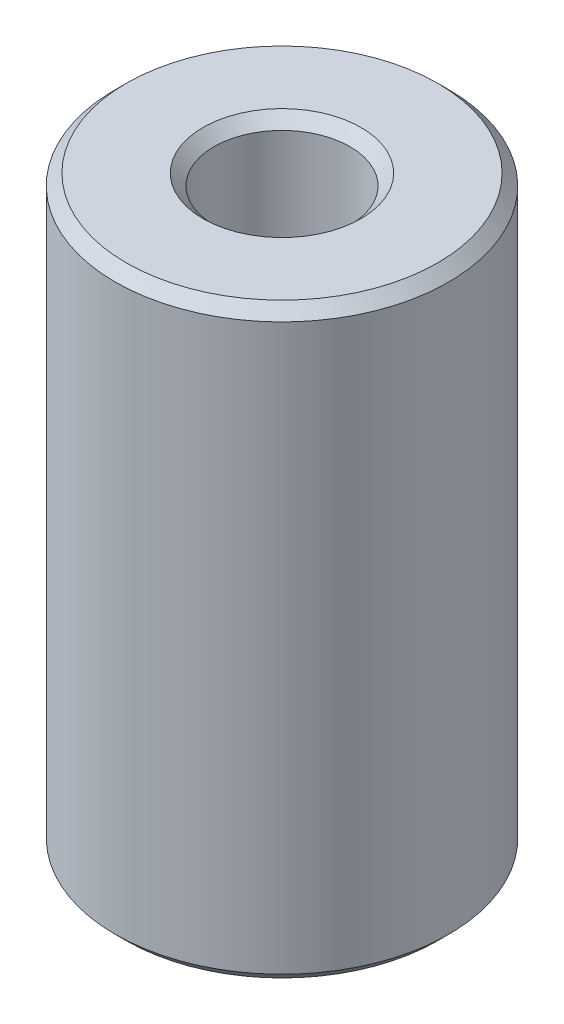
from build123d import *

# Parameters (mm, degrees)
SKETCH1_R           = 55
BOSS_EXTRUDE1_DEPTH = 193.689420812
SKETCH2_R           = 22.419370776
CUT_EXTRUDE1_DEPTH  = 209.723721063
CHAMFER1_SIZE       = 3.648701826


with BuildPart() as part:
    # Sketch1 → Boss-Extrude1 (new body)
    with BuildSketch(Plane(origin=(0, 0, 0), x_dir=(1, 0, 0), z_dir=(0, 1, 0))):
        Circle(SKETCH1_R)
    extrude(amount=BOSS_EXTRUDE1_DEPTH)

    # Sketch2 → Cut-Extrude1 (cut, through all)
    with BuildSketch(Plane(origin=(0, 0, 0), x_dir=(1, 0, 0), z_dir=(0, 1, 0))):
        Circle(SKETCH2_R)
    extrude(amount=CUT_EXTRUDE1_DEPTH, mode=Mode.SUBTRACT)

    # Chamfer1
    chamfer1_edges = [part.edges().sort_by_distance(p)[0] for p in [
        (-22.419370776, 193.689420812, 0),
        (-22.419370776, 0, 0),
        (-55, 0, 0),
        (-55, 193.689420812, 0),
    ]]
    chamfer(chamfer1_edges, length=CHAMFER1_SIZE)


solid = part.part
